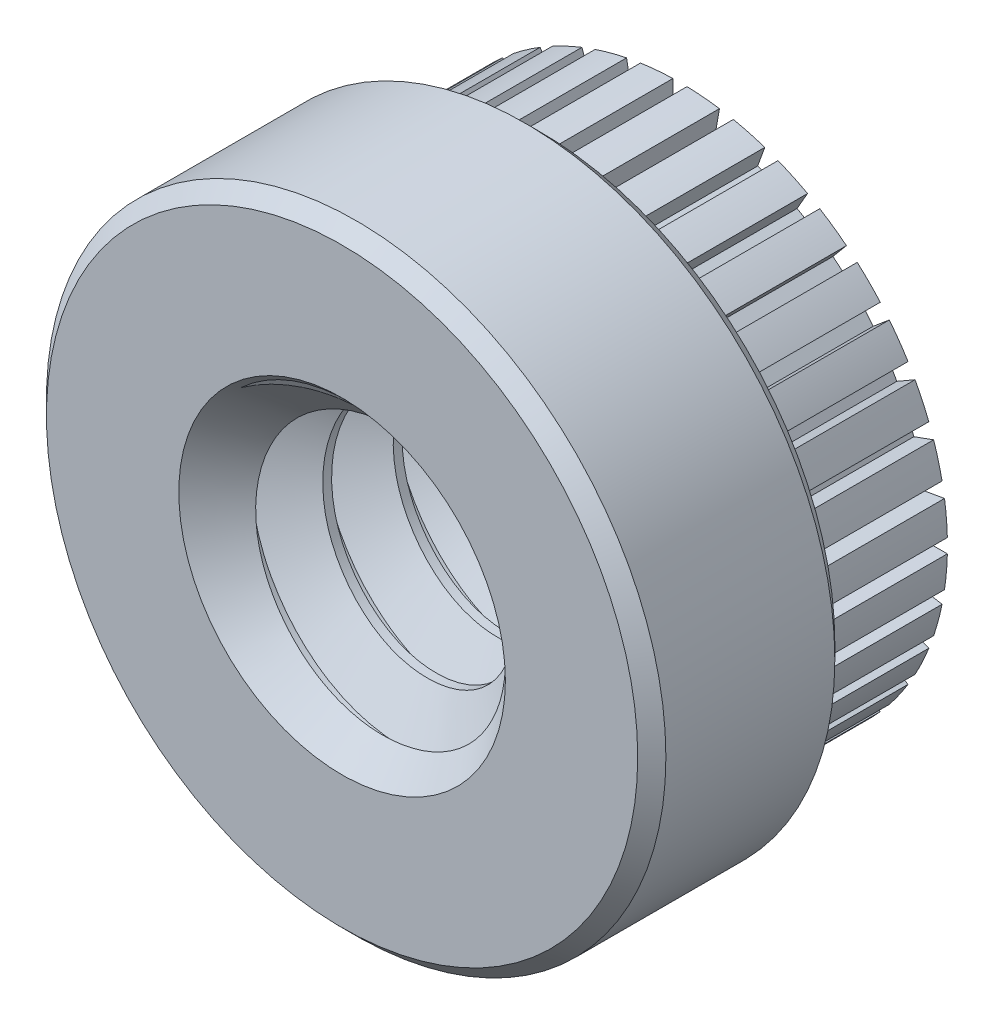
from build123d import *

# Parameters (mm, degrees)
SKETCH1_R               = 2.794
EXTRUDE1_DEPTH          = 1.778
SKETCH2_R               = 2.413
EXTRUDE2_DEPTH          = 1.524
SKETCH3_W               = 0.127
SKETCH3_H               = 0.5715
CUT_EXTRUDE_THIN1_DEPTH = 1.524
CIRPATTERN1_COUNT       = 36
SKETCH5_OUTSIDE_W       = 9.3
SKETCH5_OUTSIDE_H       = 9.3
SKETCH5_OUTSIDE_R       = 1.9685
CUT_EXTRUDE1_DEPTH      = 0.254
CHAMFER1_SIZE           = 0.127
SKETCH6_R               = 2.794
SKETCH6_R_2             = 1.9685
CUT_EXTRUDE2_DEPTH      = 0.127
CHAMFER2_SIZE           = 0.127
SKETCH7_R               = 1.4224
CUT_EXTRUDE3_DEPTH      = 6.149376273
SWEEP1_PITCH            = 0.635
SKETCH10_R              = 2.667
CUT_EXTRUDE4_DEPTH      = 6.522392251
SKETCH11_R              = 1.8415
CUT_EXTRUDE5_DEPTH      = 6.149376337


with BuildPart() as part:
    # Sketch1 → Extrude1 (new body)
    with BuildSketch(Plane.XY):
        Circle(SKETCH1_R)
    extrude(amount=-EXTRUDE1_DEPTH)

    # Sketch2 → Extrude2 (add)
    with BuildSketch(Plane(origin=(0, 0, -1.778), x_dir=(-1, 0, 0), z_dir=(0, 0, -1))):
        with Locations(Location((0, 0, 0), (0, 0, 180))):
            Circle(SKETCH2_R)
    extrude(amount=EXTRUDE2_DEPTH)

    # Sketch3 → Cut-Extrude-Thin1 (cut)
    with BuildSketch(Plane(origin=(0, 0, -3.302), x_dir=(-1, 0, 0), z_dir=(0, 0, -1))):
        with Locations((0, 2.50825)):
            Rectangle(SKETCH3_W, SKETCH3_H)
    cut_extrude_thin1 = extrude(amount=-CUT_EXTRUDE_THIN1_DEPTH, mode=Mode.SUBTRACT)

    # CirPattern1: Cut-Extrude-Thin1 ×36 about axis
    cirpattern1_axis = Axis((0, 0, 0), (0, 0, 1))
    for i in range(1, CIRPATTERN1_COUNT):
        add(cut_extrude_thin1.rotate(cirpattern1_axis, i * 360 / CIRPATTERN1_COUNT), mode=Mode.SUBTRACT)

    # Sketch5 outside → Cut-Extrude1 (cut)
    with BuildSketch(Plane(origin=(0, 0, -3.302), x_dir=(-1, 0, 0), z_dir=(0, 0, -1))):
        Rectangle(SKETCH5_OUTSIDE_W, SKETCH5_OUTSIDE_H)
        Circle(SKETCH5_OUTSIDE_R, mode=Mode.SUBTRACT)
    extrude(amount=-CUT_EXTRUDE1_DEPTH, mode=Mode.SUBTRACT)

    # Chamfer1
    chamfer1_edges = [part.edges().sort_by_distance(p)[0] for p in [
        (1.9685, 0, -3.302),
    ]]
    chamfer(chamfer1_edges, length=CHAMFER1_SIZE)

    # Sketch6 → Cut-Extrude2 (cut)
    with BuildSketch(Plane(origin=(0, 0, -1.778), x_dir=(-1, 0, 0), z_dir=(0, 0, -1))):
        with Locations(Location((0, 0, 0), (0, 0, 180))):
            Circle(SKETCH6_R)
        Circle(SKETCH6_R_2, mode=Mode.SUBTRACT)
    extrude(amount=CUT_EXTRUDE2_DEPTH, mode=Mode.SUBTRACT)

    # Chamfer2
    chamfer2_edges = [part.edges().sort_by_distance(p)[0] for p in [
        (-2.794, 0, 0),
        (-2.794, 0, -1.778),
    ]]
    chamfer(chamfer2_edges, length=CHAMFER2_SIZE)

    # Sketch7 → Cut-Extrude3 (cut, through all)
    with BuildSketch(Plane.XY):
        Circle(SKETCH7_R)
    extrude(amount=-CUT_EXTRUDE3_DEPTH, mode=Mode.SUBTRACT)

    # Sweep1: the profile of Sketch9 profile screwed along a right-hand helix of 7.8 turns, 6 arcs to a turn; built about Z, then put on its axis
    sweep1_z = Axis((0, 0, 0), (0, 0, 1))
    sweep1_corners = [(1.423, 0, -0.55597141), (1.009955401, 0, -0.3175), (1.009955401, 0, -0.238125), (1.423, 0, 0.00034641)]
    with BuildLine(mode=Mode.PRIVATE) as sweep1_profile:
        Line(sweep1_corners[0], sweep1_corners[1])
        Line(sweep1_corners[1], sweep1_corners[2])
        Line(sweep1_corners[2], sweep1_corners[3])
        Line(sweep1_corners[3], sweep1_corners[0])
    sweep1_cap = Face(sweep1_profile.wire())
    sweep1_turn_angles = [0, 30, 60, 90, 120, 150, 180, 210, 240, 270, 300, 330, 360]
    sweep1_turn_weights = [1, 0.8660254037844387, 1, 0.8660254037844387, 1, 0.8660254037844387, 1, 0.8660254037844387, 1, 0.8660254037844387, 1, 0.8660254037844387, 1]
    sweep1_turn_rails = [Edge.make_bspline([Vector(p[0], p[1], 0).rotate(sweep1_z, sweep1_turn_angles[k]) / sweep1_turn_weights[k] + Vector(0, 0, p[2] + SWEEP1_PITCH * sweep1_turn_angles[k] / 360) for k in range(13)], [0, 0, 0, 1, 1, 2, 2, 3, 3, 4, 4, 5, 5, 6, 6, 6], 2, sweep1_turn_weights) for p in sweep1_corners]
    sweep1_turn_sides = [Face.make_surface_from_curves(sweep1_turn_rails[p[0]], sweep1_turn_rails[p[1]]) for p in [(0, 1), (1, 2), (2, 3), (3, 0)]]
    sweep1_last_angles = [2520, 2550, 2580, 2610, 2640, 2670, 2700, 2730, 2760, 2784, 2808]
    sweep1_last_weights = [1, 0.8660254037844387, 1, 0.8660254037844387, 1, 0.8660254037844387, 1, 0.8660254037844387, 1, 0.9135454576425848, 1]
    sweep1_last_rails = [Edge.make_bspline([Vector(p[0], p[1], 0).rotate(sweep1_z, sweep1_last_angles[k]) / sweep1_last_weights[k] + Vector(0, 0, p[2] + SWEEP1_PITCH * sweep1_last_angles[k] / 360) for k in range(11)], [0, 0, 0, 1, 1, 2, 2, 3, 3, 4, 4, 5, 5, 5], 2, sweep1_last_weights) for p in sweep1_corners]
    sweep1_last_sides = [Face.make_surface_from_curves(sweep1_last_rails[p[0]], sweep1_last_rails[p[1]]) for p in [(0, 1), (1, 2), (2, 3), (3, 0)]]
    sweep1 = Plane(origin=(0, 0, -3.302), x_dir=(0, 1, 0), z_dir=(0, 0, 1)) * Solid(Shell([*[p.moved(Location((0, 0, SWEEP1_PITCH * i))) for i in range(7) for p in sweep1_turn_sides], *sweep1_last_sides, sweep1_cap, sweep1_cap.rotate(sweep1_z, 2808).moved(Location((0, 0, SWEEP1_PITCH * 2808 / 360)))]))
    add(sweep1)

    # Sketch10 → Cut-Extrude4 (cut, through all)
    with BuildSketch(Plane.XY):
        Circle(SKETCH10_R)
    extrude(amount=CUT_EXTRUDE4_DEPTH, mode=Mode.SUBTRACT)

    # Sketch11 → Cut-Extrude5 (cut, through all)
    with BuildSketch(Plane(origin=(0, 0, -3.302), x_dir=(-1, 0, 0), z_dir=(0, 0, -1))):
        Circle(SKETCH11_R)
    extrude(amount=CUT_EXTRUDE5_DEPTH, mode=Mode.SUBTRACT)

    # Cut-Extrude6 cone 1 section (through the dimple's axis) → Cut-Extrude6 (revolve, cut)
    with BuildSketch(Plane(origin=(0, 0, 0), x_dir=(0, -1, 0), z_dir=(1, 0, 0))):
        Polygon((0, 0), (1.4732, 0), (0, 1.4732), align=None)
    revolve(axis=Axis((0, 0, 0), (0, 0, -1)), mode=Mode.SUBTRACT)

    # Cut-Extrude7 cone 1 section (through the dimple's axis) → Cut-Extrude7 (revolve, cut)
    with BuildSketch(Plane(origin=(0, 0, -3.302), x_dir=(0, 1, 0), z_dir=(1, 0, 0))):
        Polygon((0, 0), (1.4732, 0), (0, 1.4732), align=None)
    revolve(axis=Axis((0, 0, -3.302), (0, 0, 1)), mode=Mode.SUBTRACT)


solid = part.part
